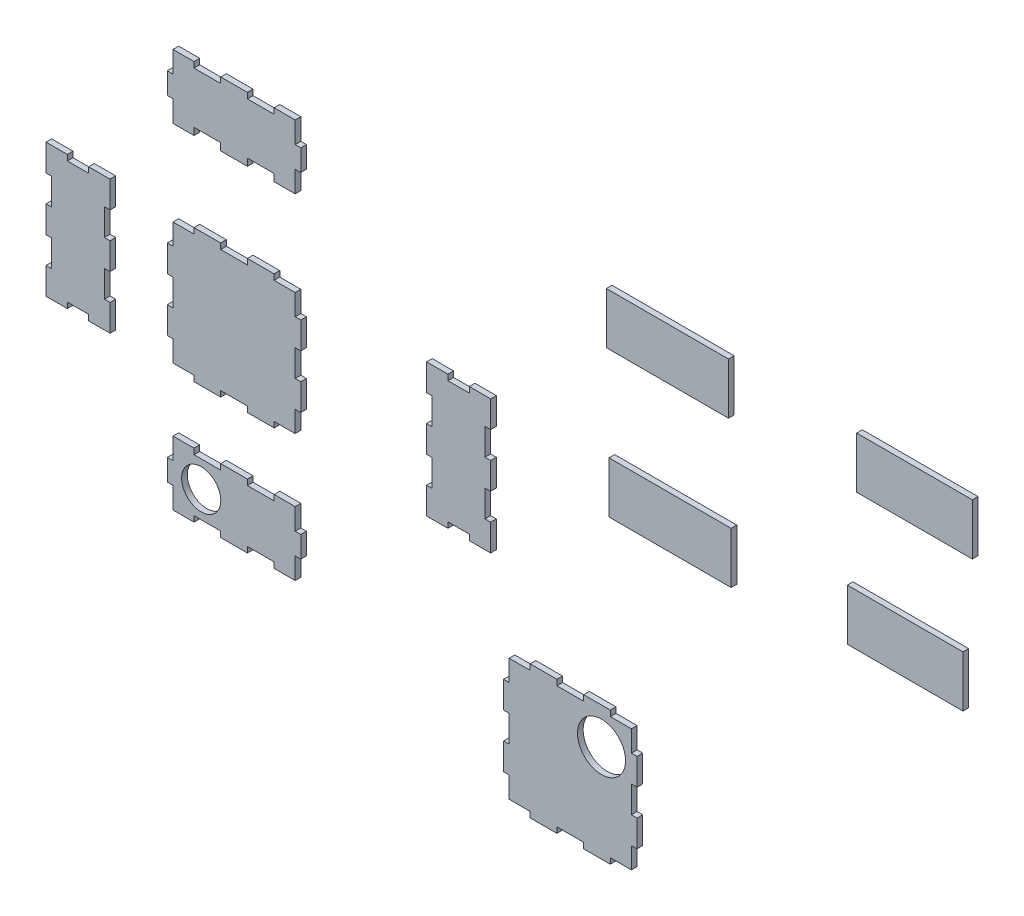
from build123d import *

# Parameters (mm, degrees)
SKETCH1_W              = 75
SKETCH1_H              = 75
BOSS_EXTRUDE1_DEPTH    = 3.18
BOSS_EXTRUDE1_2_DEPTH  = 3.18
SKETCH1_H_2            = 36
BOSS_EXTRUDE1_3_DEPTH  = 3.18
SKETCH1_W_2            = 36
BOSS_EXTRUDE1_4_DEPTH  = 3.18
BOSS_EXTRUDE1_5_DEPTH  = 3.18
BOSS_EXTRUDE1_6_DEPTH  = 3.18
SKETCH1_W_3            = 68.6
SKETCH1_H_3            = 28.8
BOSS_EXTRUDE1_7_DEPTH  = 3.18
BOSS_EXTRUDE1_8_DEPTH  = 3.18
SKETCH1_W_4            = 65
BOSS_EXTRUDE1_9_DEPTH  = 3.18
BOSS_EXTRUDE1_10_DEPTH = 3.18
SKETCH2_W              = 3.18
SKETCH2_H              = 15
CUT_EXTRUDE1_DEPTH     = 3.18
SKETCH2_4_W            = 15
SKETCH2_4_H            = 3.18
SKETCH2_4_W_2          = 3.18
SKETCH2_4_H_2          = 15
CUT_EXTRUDE2_DEPTH     = 3.18
SKETCH3_W              = 15
SKETCH3_H              = 4.028218766
CUT_EXTRUDE3_DEPTH     = 3.18
SKETCH3_5_W            = 3.18
SKETCH3_5_H            = 15
SKETCH3_5_W_2          = 3.17
SKETCH3_5_W_3          = 15
SKETCH3_5_H_2          = 3.18
CUT_EXTRUDE4_DEPTH     = 3.18
SKETCH3_6_W            = 12
SKETCH3_6_H            = 3.18
CUT_EXTRUDE5_DEPTH     = 3.18
SKETCH3_7_W            = 12
SKETCH3_7_H            = 3.18
CUT_EXTRUDE6_DEPTH     = 3.18
SKETCH3_10_W           = 3.18
SKETCH3_10_H           = 12
SKETCH3_10_H_2         = 8.82
CUT_EXTRUDE7_DEPTH     = 3.18
SKETCH3_11_W           = 3.18
SKETCH3_11_H           = 12
SKETCH3_11_H_2         = 8.82
CUT_EXTRUDE8_DEPTH     = 3.18
SKETCH3_12_W           = 3.18
SKETCH3_12_H           = 15
SKETCH3_12_W_2         = 15
SKETCH3_12_H_2         = 3.18
CUT_EXTRUDE9_DEPTH     = 3.18
SKETCH3_13_W           = 3.18
SKETCH3_13_H           = 3.18
CUT_EXTRUDE10_DEPTH    = 3.18
SKETCH2_5_W            = 15
SKETCH2_5_H            = 3.18
SKETCH2_5_W_2          = 3.18
SKETCH2_5_H_2          = 15
CUT_EXTRUDE11_DEPTH    = 3.18
SKETCH4_R              = 13.5
CUT_EXTRUDE13_DEPTH    = 3.18
SKETCH5_R              = 11
CUT_EXTRUDE14_DEPTH    = 3.18


with BuildPart() as part:
    # Sketch1 → Boss-Extrude1 (new body)
    with BuildSketch(Plane.XY):
        with Locations((95.667895807, -52.035279616)):
            Rectangle(SKETCH1_W, SKETCH1_H)
    extrude(amount=BOSS_EXTRUDE1_DEPTH)

    # Sketch2<5> → Cut-Extrude11 (cut)
    with BuildSketch(Plane.XY.offset(3.18)):
        Polygon((58.125884085, -14.535279616), (58.125884085, -29.535279616), (61.305884085, -29.535279616), (61.305884085, -17.715279616), (73.125884085, -17.715279616), (73.125884085, -14.535279616), align=None)
        with Locations((95.625884085, -16.125279616)):
            Rectangle(SKETCH2_5_W, SKETCH2_5_H)
        with Locations((59.715884085, -52.035279616)):
            Rectangle(SKETCH2_5_W_2, SKETCH2_5_H_2)
        Polygon((118.125884085, -14.535279616), (118.125884085, -17.715279616), (129.987895807, -17.715279616), (129.987895807, -29.535279616), (133.167895807, -29.535279616), (133.167895807, -14.535279616), align=None)
        Polygon((61.305884085, -74.535279616), (58.125884085, -74.535279616), (58.125884085, -89.540059314), (73.125884085, -89.540059314), (73.125884085, -86.360059314), (61.305884085, -86.360059314), align=None)
        with Locations((95.625884085, -87.950059314)):
            Rectangle(SKETCH2_5_W, SKETCH2_5_H)
        with Locations((131.577895807, -52.035279616)):
            Rectangle(SKETCH2_5_W_2, SKETCH2_5_H_2)
        Polygon((129.987895807, -86.360059314), (118.125884085, -86.360059314), (118.125884085, -89.540059314), (133.167895807, -89.540059314), (133.167895807, -74.535279616), (129.987895807, -74.535279616), align=None)
    extrude(amount=-CUT_EXTRUDE11_DEPTH, mode=Mode.SUBTRACT)

    # Sketch4 → Cut-Extrude13 (cut)
    with BuildSketch(Plane.XY.offset(3.18)):
        with Locations((113.189406371, -34.904238969)):
            Circle(SKETCH4_R)
    extrude(amount=-CUT_EXTRUDE13_DEPTH, mode=Mode.SUBTRACT)


with BuildPart() as body_2:
    # Sketch1 → Boss-Extrude1 2 (new body)
    with BuildSketch(Plane.XY):
        with Locations((-93.24924832, 65.780568854)):
            Rectangle(SKETCH1_W, SKETCH1_H)
    extrude(amount=BOSS_EXTRUDE1_2_DEPTH)

    # Sketch2 → Cut-Extrude1 (cut)
    with BuildSketch(Plane.XY.offset(3.18)):
        with Locations((-129.15924832, 65.780568854)):
            Rectangle(SKETCH2_W, SKETCH2_H)
    extrude(amount=-CUT_EXTRUDE1_DEPTH, mode=Mode.SUBTRACT)

    # Sketch2<4> → Cut-Extrude2 (cut)
    with BuildSketch(Plane.XY.offset(3.18)):
        Polygon((-130.74924832, 103.280568854), (-130.74924832, 88.280568854), (-127.56924832, 88.280568854), (-127.56924832, 100.100568854), (-115.74924832, 100.100568854), (-115.74924832, 103.280568854), align=None)
        with Locations((-93.24924832, 101.690568854)):
            Rectangle(SKETCH2_4_W, SKETCH2_4_H)
        Polygon((-70.74924832, 103.280568854), (-70.74924832, 100.100568854), (-58.92924832, 100.100568854), (-58.92924832, 88.280568854), (-55.74924832, 88.280568854), (-55.74924832, 103.280568854), align=None)
        Polygon((-127.56924832, 43.280568854), (-130.74924832, 43.280568854), (-130.74924832, 28.280568854), (-115.74924832, 28.280568854), (-115.74924832, 31.460568854), (-127.56924832, 31.460568854), align=None)
        with Locations((-93.24924832, 29.870568854)):
            Rectangle(SKETCH2_4_W, SKETCH2_4_H)
        with Locations((-57.33924832, 65.780568854)):
            Rectangle(SKETCH2_4_W_2, SKETCH2_4_H_2)
        Polygon((-58.92924832, 31.460568854), (-70.74924832, 31.460568854), (-70.74924832, 28.280568854), (-55.74924832, 28.280568854), (-55.74924832, 43.280568854), (-58.92924832, 43.280568854), align=None)
    extrude(amount=-CUT_EXTRUDE2_DEPTH, mode=Mode.SUBTRACT)


with BuildPart() as body_3:
    # Sketch1 → Boss-Extrude1 3 (new body)
    with BuildSketch(Plane.XY):
        with Locations((-93.24924832, 166.06777372)):
            Rectangle(SKETCH1_W, SKETCH1_H_2)
    extrude(amount=BOSS_EXTRUDE1_3_DEPTH)

    # Sketch3 → Cut-Extrude3 (cut)
    with BuildSketch(Plane.XY.offset(3.18)):
        with Locations((-108.24924832, 150.081883103)):
            Rectangle(SKETCH3_W, SKETCH3_H)
        with Locations((-78.24924832, 150.081883103)):
            Rectangle(SKETCH3_W, SKETCH3_H)
    extrude(amount=-CUT_EXTRUDE3_DEPTH, mode=Mode.SUBTRACT)

    # Sketch3<10> → Cut-Extrude7 (cut)
    with BuildSketch(Plane.XY.offset(3.18)):
        with Locations((-129.15924832, 154.06777372)):
            Rectangle(SKETCH3_10_W, SKETCH3_10_H)
        with Locations((-129.15924832, 176.47777372)):
            Rectangle(SKETCH3_10_W, SKETCH3_10_H_2)
        with Locations((-57.33924832, 154.06777372)):
            Rectangle(SKETCH3_10_W, SKETCH3_10_H)
        with Locations((-57.33924832, 176.47777372)):
            Rectangle(SKETCH3_10_W, SKETCH3_10_H_2)
    extrude(amount=-CUT_EXTRUDE7_DEPTH, mode=Mode.SUBTRACT)


with BuildPart() as body_4:
    # Sketch1 → Boss-Extrude1 4 (new body)
    with BuildSketch(Plane.XY):
        with Locations((-180.894719251, 65.780568854)):
            Rectangle(SKETCH1_W_2, SKETCH1_H)
    extrude(amount=BOSS_EXTRUDE1_4_DEPTH)


with BuildPart() as body_5:
    # Sketch1 → Boss-Extrude1 5 (new body)
    with BuildSketch(Plane.XY):
        with Locations((-93.24924832, -22.048044281)):
            Rectangle(SKETCH1_W, SKETCH1_H_2)
    extrude(amount=BOSS_EXTRUDE1_5_DEPTH)


with BuildPart() as body_6:
    # Sketch1 → Boss-Extrude1 6 (new body)
    with BuildSketch(Plane.XY):
        with Locations((32.90826227, 65.780568854)):
            Rectangle(SKETCH1_W_2, SKETCH1_H)
    extrude(amount=BOSS_EXTRUDE1_6_DEPTH)


with BuildPart() as body_7:
    # Sketch1 → Boss-Extrude1 7 (new body)
    with BuildSketch(Plane.XY):
        with Locations((151.717722093, 93.435300016)):
            Rectangle(SKETCH1_W_3, SKETCH1_H_3)
    extrude(amount=BOSS_EXTRUDE1_7_DEPTH)


with BuildPart() as body_8:
    # Sketch1 → Boss-Extrude1 8 (new body)
    with BuildSketch(Plane.XY):
        with Locations((150.229753993, 175.065157688)):
            Rectangle(SKETCH1_W_3, SKETCH1_H_3)
    extrude(amount=BOSS_EXTRUDE1_8_DEPTH)


with BuildPart() as body_9:
    # Sketch1 → Boss-Extrude1 9 (new body)
    with BuildSketch(Plane.XY):
        with Locations((283.792366273, 98.462260752)):
            Rectangle(SKETCH1_W_4, SKETCH1_H_3)
    extrude(amount=BOSS_EXTRUDE1_9_DEPTH)


with BuildPart() as body_10:
    # Sketch1 → Boss-Extrude1 10 (new body)
    with BuildSketch(Plane.XY):
        with Locations((289.025342958, 175.065157688)):
            Rectangle(SKETCH1_W_4, SKETCH1_H_3)
    extrude(amount=BOSS_EXTRUDE1_10_DEPTH)


with BuildPart() as cut_extrude4_tool:
    # Sketch3<5> → Cut-Extrude4 (new body)
    with BuildSketch(Plane.XY.offset(3.18)):
        with Locations((-164.484719251, 80.780568854)):
            Rectangle(SKETCH3_5_W, SKETCH3_5_H)
        with Locations((-164.484719251, 50.780568854)):
            Rectangle(SKETCH3_5_W, SKETCH3_5_H)
        with Locations((16.49326227, 80.780568854)):
            Rectangle(SKETCH3_5_W_2, SKETCH3_5_H)
        with Locations((16.49326227, 50.780568854)):
            Rectangle(SKETCH3_5_W_2, SKETCH3_5_H)
        with Locations((-108.24924832, -5.638044281)):
            Rectangle(SKETCH3_5_W_3, SKETCH3_5_H_2)
        with Locations((-78.24924832, -5.638044281)):
            Rectangle(SKETCH3_5_W_3, SKETCH3_5_H_2)
    extrude(amount=-CUT_EXTRUDE4_DEPTH)


with BuildPart() as body_4_1:
    add(body_4.part)

    # Cut-Extrude4: cut by cut_extrude4_tool
    add(cut_extrude4_tool.part, mode=Mode.SUBTRACT)

    # Sketch3<6> → Cut-Extrude5 (cut)
    with BuildSketch(Plane.XY.offset(3.18)):
        with Locations((-180.894719251, 101.690568854)):
            Rectangle(SKETCH3_6_W, SKETCH3_6_H)
        with Locations((-180.894719251, 29.870568854)):
            Rectangle(SKETCH3_6_W, SKETCH3_6_H)
    extrude(amount=-CUT_EXTRUDE5_DEPTH, mode=Mode.SUBTRACT)


with BuildPart() as body_5_1:
    add(body_5.part)

    # Cut-Extrude4: cut by cut_extrude4_tool
    add(cut_extrude4_tool.part, mode=Mode.SUBTRACT)

    # Sketch3<11> → Cut-Extrude8 (cut)
    with BuildSketch(Plane.XY.offset(3.18)):
        with Locations((-129.15924832, -10.048044281)):
            Rectangle(SKETCH3_11_W, SKETCH3_11_H)
        with Locations((-129.15924832, -32.458044281)):
            Rectangle(SKETCH3_11_W, SKETCH3_11_H_2)
        with Locations((-57.33924832, -10.048044281)):
            Rectangle(SKETCH3_11_W, SKETCH3_11_H)
        with Locations((-57.33924832, -32.458044281)):
            Rectangle(SKETCH3_11_W, SKETCH3_11_H_2)
    extrude(amount=-CUT_EXTRUDE8_DEPTH, mode=Mode.SUBTRACT)


with BuildPart() as body_6_1:
    add(body_6.part)

    # Cut-Extrude4: cut by cut_extrude4_tool
    add(cut_extrude4_tool.part, mode=Mode.SUBTRACT)

    # Sketch3<7> → Cut-Extrude6 (cut)
    with BuildSketch(Plane.XY.offset(3.18)):
        with Locations((32.90826227, 101.690568854)):
            Rectangle(SKETCH3_7_W, SKETCH3_7_H)
        with Locations((32.90826227, 29.870568854)):
            Rectangle(SKETCH3_7_W, SKETCH3_7_H)
    extrude(amount=-CUT_EXTRUDE6_DEPTH, mode=Mode.SUBTRACT)


with BuildPart() as cut_extrude9_tool:
    # Sketch3<12> → Cut-Extrude9 (new body)
    with BuildSketch(Plane.XY.offset(3.18)):
        with Locations((-197.304719251, 80.780568854)):
            Rectangle(SKETCH3_12_W, SKETCH3_12_H)
        with Locations((-197.304719251, 50.780568854)):
            Rectangle(SKETCH3_12_W, SKETCH3_12_H)
        with Locations((49.31826227, 80.780568854)):
            Rectangle(SKETCH3_12_W, SKETCH3_12_H)
        with Locations((49.31826227, 50.780568854)):
            Rectangle(SKETCH3_12_W, SKETCH3_12_H)
        with Locations((-108.24924832, 182.47777372)):
            Rectangle(SKETCH3_12_W_2, SKETCH3_12_H_2)
        with Locations((-78.24924832, 182.47777372)):
            Rectangle(SKETCH3_12_W_2, SKETCH3_12_H_2)
        with Locations((-108.24924832, -38.458044281)):
            Rectangle(SKETCH3_12_W_2, SKETCH3_12_H_2)
        with Locations((-78.24924832, -38.458044281)):
            Rectangle(SKETCH3_12_W_2, SKETCH3_12_H_2)
    extrude(amount=-CUT_EXTRUDE9_DEPTH)


with BuildPart() as body_3_1:
    add(body_3.part)

    # Cut-Extrude9: cut by cut_extrude9_tool
    add(cut_extrude9_tool.part, mode=Mode.SUBTRACT)


with BuildPart() as body_4_2:
    add(body_4_1.part)

    # Cut-Extrude9: cut by cut_extrude9_tool
    add(cut_extrude9_tool.part, mode=Mode.SUBTRACT)


with BuildPart() as body_5_2:
    add(body_5_1.part)

    # Cut-Extrude9: cut by cut_extrude9_tool
    add(cut_extrude9_tool.part, mode=Mode.SUBTRACT)


with BuildPart() as body_6_2:
    add(body_6_1.part)

    # Cut-Extrude9: cut by cut_extrude9_tool
    add(cut_extrude9_tool.part, mode=Mode.SUBTRACT)


with BuildPart() as cut_extrude10_tool:
    # Sketch3<13> → Cut-Extrude10 (new body)
    with BuildSketch(Plane.XY.offset(3.18)):
        with Locations((-129.15924832, 182.47777372)):
            Rectangle(SKETCH3_13_W, SKETCH3_13_H)
        with Locations((-57.33924832, 182.47777372)):
            Rectangle(SKETCH3_13_W, SKETCH3_13_H)
        with Locations((-129.15924832, -38.458044281)):
            Rectangle(SKETCH3_13_W, SKETCH3_13_H)
        with Locations((-57.33924832, -38.458044281)):
            Rectangle(SKETCH3_13_W, SKETCH3_13_H)
    extrude(amount=-CUT_EXTRUDE10_DEPTH)


with BuildPart() as body_3_2:
    add(body_3_1.part)

    # Cut-Extrude10: cut by cut_extrude10_tool
    add(cut_extrude10_tool.part, mode=Mode.SUBTRACT)


with BuildPart() as body_5_3:
    add(body_5_2.part)

    # Cut-Extrude10: cut by cut_extrude10_tool
    add(cut_extrude10_tool.part, mode=Mode.SUBTRACT)

    # Sketch5 → Cut-Extrude14 (cut)
    with BuildSketch(Plane.XY.offset(3.18)):
        with Locations((-111.703752702, -22.048044281)):
            Circle(SKETCH5_R)
    extrude(amount=-CUT_EXTRUDE14_DEPTH, mode=Mode.SUBTRACT)


solid = Compound([part.part, body_2.part, body_7.part, body_8.part, body_9.part, body_10.part, body_4_2.part, body_6_2.part, body_3_2.part, body_5_3.part])
